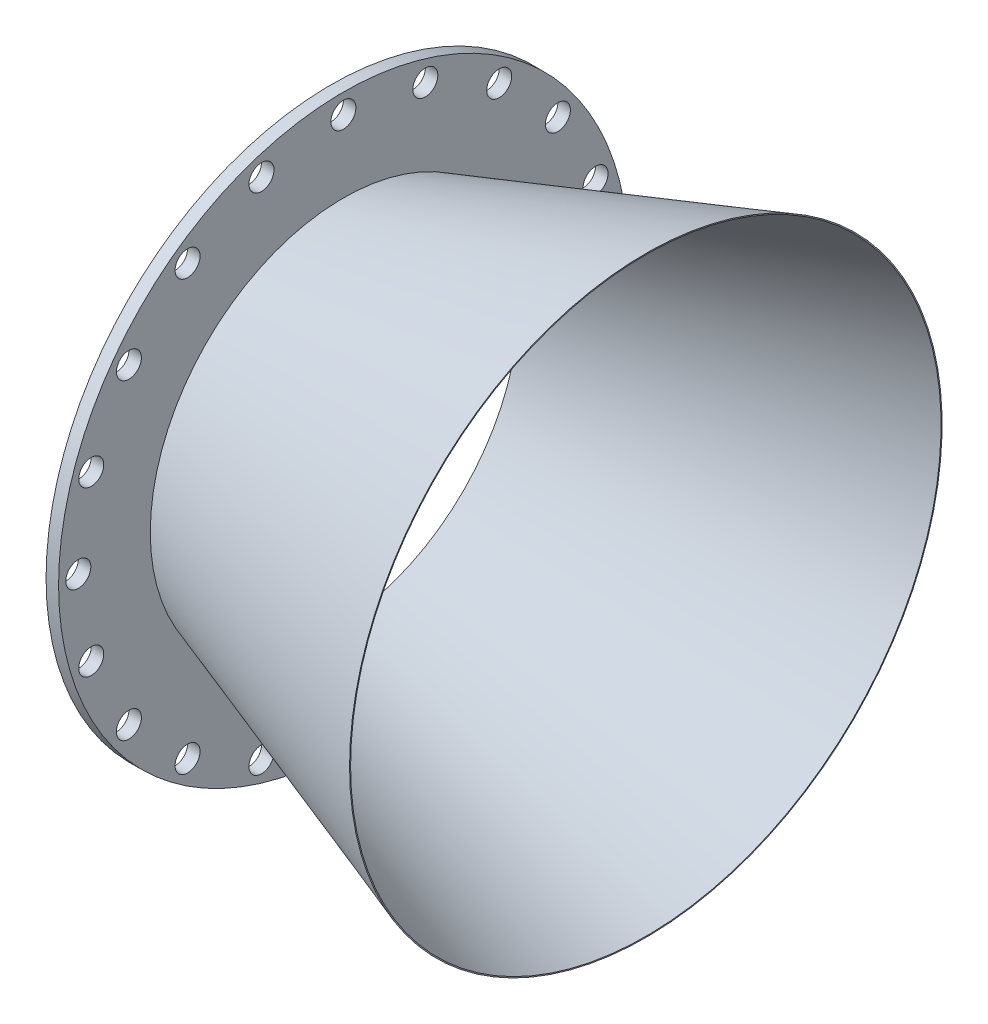
from build123d import *

# Parameters (mm, degrees)
CUT_EXTRUDE1_REACH = 135.082
SKETCH4_R          = 3.175


with BuildPart() as part:
    # Sketch1 → Revolve1 (revolve)
    with BuildSketch(Plane.XY):
        Polygon((0, 47.6758), (79.9592, 74.9554), (79.9592, 75.223775525), (0, 47.944175525), align=None)
    revolve(axis=Axis((0, 0, 0), (1, 0, 0)))

    # Sketch3 → Revolve2 (revolve)
    with BuildSketch(Plane.XY):
        Polygon((0, 47.944175525), (3.175, 49.027387088), (3.175, 72.3138), (0, 72.3138), align=None)
    revolve(axis=Axis((0, 0, 0), (1, 0, 0)))

    # Sketch4 → Cut-Extrude1 (cut, up to next)
    with BuildSketch(Plane.ZY, mode=Mode.PRIVATE) as cut_extrude1_sk1:
        with Locations((0, 67.31)):
            Circle(SKETCH4_R)
    cut_extrude1_tool1 = extrude(cut_extrude1_sk1.sketch, amount=-CUT_EXTRUDE1_REACH, mode=Mode.PRIVATE) & part.part
    # Sketch4 → Cut-Extrude1 (cut, up to next)
    with BuildSketch(Plane.ZY, mode=Mode.PRIVATE) as cut_extrude1_sk2:
        with Locations((20.799933891, 64.015614112)):
            Circle(SKETCH4_R)
    cut_extrude1_tool2 = extrude(cut_extrude1_sk2.sketch, amount=-CUT_EXTRUDE1_REACH, mode=Mode.PRIVATE) & part.part
    # Sketch4 → Cut-Extrude1 (cut, up to next)
    with BuildSketch(Plane.ZY, mode=Mode.PRIVATE) as cut_extrude1_sk3:
        with Locations((39.563825332, 54.454933891)):
            Circle(SKETCH4_R)
    cut_extrude1_tool3 = extrude(cut_extrude1_sk3.sketch, amount=-CUT_EXTRUDE1_REACH, mode=Mode.PRIVATE) & part.part
    # Sketch4 → Cut-Extrude1 (cut, up to next)
    with BuildSketch(Plane.ZY, mode=Mode.PRIVATE) as cut_extrude1_sk4:
        with Locations((54.454933891, 39.563825332)):
            Circle(SKETCH4_R)
    cut_extrude1_tool4 = extrude(cut_extrude1_sk4.sketch, amount=-CUT_EXTRUDE1_REACH, mode=Mode.PRIVATE) & part.part
    # Sketch4 → Cut-Extrude1 (cut, up to next)
    with BuildSketch(Plane.ZY, mode=Mode.PRIVATE) as cut_extrude1_sk5:
        with Locations((64.015614112, 20.799933891)):
            Circle(SKETCH4_R)
    cut_extrude1_tool5 = extrude(cut_extrude1_sk5.sketch, amount=-CUT_EXTRUDE1_REACH, mode=Mode.PRIVATE) & part.part
    # Sketch4 → Cut-Extrude1 (cut, up to next)
    with BuildSketch(Plane.ZY, mode=Mode.PRIVATE) as cut_extrude1_sk6:
        with Locations((67.31, 0)):
            Circle(SKETCH4_R)
    cut_extrude1_tool6 = extrude(cut_extrude1_sk6.sketch, amount=-CUT_EXTRUDE1_REACH, mode=Mode.PRIVATE) & part.part
    # Sketch4 → Cut-Extrude1 (cut, up to next)
    with BuildSketch(Plane.ZY, mode=Mode.PRIVATE) as cut_extrude1_sk7:
        with Locations((64.015614112, -20.799933891)):
            Circle(SKETCH4_R)
    cut_extrude1_tool7 = extrude(cut_extrude1_sk7.sketch, amount=-CUT_EXTRUDE1_REACH, mode=Mode.PRIVATE) & part.part
    # Sketch4 → Cut-Extrude1 (cut, up to next)
    with BuildSketch(Plane.ZY, mode=Mode.PRIVATE) as cut_extrude1_sk8:
        with Locations((54.454933891, -39.563825332)):
            Circle(SKETCH4_R)
    cut_extrude1_tool8 = extrude(cut_extrude1_sk8.sketch, amount=-CUT_EXTRUDE1_REACH, mode=Mode.PRIVATE) & part.part
    # Sketch4 → Cut-Extrude1 (cut, up to next)
    with BuildSketch(Plane.ZY, mode=Mode.PRIVATE) as cut_extrude1_sk9:
        with Locations((39.563825332, -54.454933891)):
            Circle(SKETCH4_R)
    cut_extrude1_tool9 = extrude(cut_extrude1_sk9.sketch, amount=-CUT_EXTRUDE1_REACH, mode=Mode.PRIVATE) & part.part
    # Sketch4 → Cut-Extrude1 (cut, up to next)
    with BuildSketch(Plane.ZY, mode=Mode.PRIVATE) as cut_extrude1_sk10:
        with Locations((20.799933891, -64.015614112)):
            Circle(SKETCH4_R)
    cut_extrude1_tool10 = extrude(cut_extrude1_sk10.sketch, amount=-CUT_EXTRUDE1_REACH, mode=Mode.PRIVATE) & part.part
    # Sketch4 → Cut-Extrude1 (cut, up to next)
    with BuildSketch(Plane.ZY, mode=Mode.PRIVATE) as cut_extrude1_sk11:
        with Locations((0, -67.31)):
            Circle(SKETCH4_R)
    cut_extrude1_tool11 = extrude(cut_extrude1_sk11.sketch, amount=-CUT_EXTRUDE1_REACH, mode=Mode.PRIVATE) & part.part
    # Sketch4 → Cut-Extrude1 (cut, up to next)
    with BuildSketch(Plane.ZY, mode=Mode.PRIVATE) as cut_extrude1_sk12:
        with Locations((-20.799933891, -64.015614112)):
            Circle(SKETCH4_R)
    cut_extrude1_tool12 = extrude(cut_extrude1_sk12.sketch, amount=-CUT_EXTRUDE1_REACH, mode=Mode.PRIVATE) & part.part
    # Sketch4 → Cut-Extrude1 (cut, up to next)
    with BuildSketch(Plane.ZY, mode=Mode.PRIVATE) as cut_extrude1_sk13:
        with Locations((-39.563825332, -54.454933891)):
            Circle(SKETCH4_R)
    cut_extrude1_tool13 = extrude(cut_extrude1_sk13.sketch, amount=-CUT_EXTRUDE1_REACH, mode=Mode.PRIVATE) & part.part
    # Sketch4 → Cut-Extrude1 (cut, up to next)
    with BuildSketch(Plane.ZY, mode=Mode.PRIVATE) as cut_extrude1_sk14:
        with Locations((-54.454933891, -39.563825332)):
            Circle(SKETCH4_R)
    cut_extrude1_tool14 = extrude(cut_extrude1_sk14.sketch, amount=-CUT_EXTRUDE1_REACH, mode=Mode.PRIVATE) & part.part
    # Sketch4 → Cut-Extrude1 (cut, up to next)
    with BuildSketch(Plane.ZY, mode=Mode.PRIVATE) as cut_extrude1_sk15:
        with Locations((-64.015614112, -20.799933891)):
            Circle(SKETCH4_R)
    cut_extrude1_tool15 = extrude(cut_extrude1_sk15.sketch, amount=-CUT_EXTRUDE1_REACH, mode=Mode.PRIVATE) & part.part
    # Sketch4 → Cut-Extrude1 (cut, up to next)
    with BuildSketch(Plane.ZY, mode=Mode.PRIVATE) as cut_extrude1_sk16:
        with Locations((-67.31, 0)):
            Circle(SKETCH4_R)
    cut_extrude1_tool16 = extrude(cut_extrude1_sk16.sketch, amount=-CUT_EXTRUDE1_REACH, mode=Mode.PRIVATE) & part.part
    # Sketch4 → Cut-Extrude1 (cut, up to next)
    with BuildSketch(Plane.ZY, mode=Mode.PRIVATE) as cut_extrude1_sk17:
        with Locations((-64.015614112, 20.799933891)):
            Circle(SKETCH4_R)
    cut_extrude1_tool17 = extrude(cut_extrude1_sk17.sketch, amount=-CUT_EXTRUDE1_REACH, mode=Mode.PRIVATE) & part.part
    # Sketch4 → Cut-Extrude1 (cut, up to next)
    with BuildSketch(Plane.ZY, mode=Mode.PRIVATE) as cut_extrude1_sk18:
        with Locations((-54.454933891, 39.563825332)):
            Circle(SKETCH4_R)
    cut_extrude1_tool18 = extrude(cut_extrude1_sk18.sketch, amount=-CUT_EXTRUDE1_REACH, mode=Mode.PRIVATE) & part.part
    # Sketch4 → Cut-Extrude1 (cut, up to next)
    with BuildSketch(Plane.ZY, mode=Mode.PRIVATE) as cut_extrude1_sk19:
        with Locations((-39.563825332, 54.454933891)):
            Circle(SKETCH4_R)
    cut_extrude1_tool19 = extrude(cut_extrude1_sk19.sketch, amount=-CUT_EXTRUDE1_REACH, mode=Mode.PRIVATE) & part.part
    # Sketch4 → Cut-Extrude1 (cut, up to next)
    with BuildSketch(Plane.ZY, mode=Mode.PRIVATE) as cut_extrude1_sk20:
        with Locations((-20.799933891, 64.015614112)):
            Circle(SKETCH4_R)
    cut_extrude1_tool20 = extrude(cut_extrude1_sk20.sketch, amount=-CUT_EXTRUDE1_REACH, mode=Mode.PRIVATE) & part.part
    add(cut_extrude1_tool1.solids().sort_by_distance((0, 67.31, 0))[0], mode=Mode.SUBTRACT)
    add(cut_extrude1_tool2.solids().sort_by_distance((0, 64.015614, 20.799934))[0], mode=Mode.SUBTRACT)
    add(cut_extrude1_tool3.solids().sort_by_distance((0, 54.454934, 39.563825))[0], mode=Mode.SUBTRACT)
    add(cut_extrude1_tool4.solids().sort_by_distance((0, 39.563825, 54.454934))[0], mode=Mode.SUBTRACT)
    add(cut_extrude1_tool5.solids().sort_by_distance((0, 20.799934, 64.015614))[0], mode=Mode.SUBTRACT)
    add(cut_extrude1_tool6.solids().sort_by_distance((0, 0, 67.31))[0], mode=Mode.SUBTRACT)
    add(cut_extrude1_tool7.solids().sort_by_distance((0, -20.799934, 64.015614))[0], mode=Mode.SUBTRACT)
    add(cut_extrude1_tool8.solids().sort_by_distance((0, -39.563825, 54.454934))[0], mode=Mode.SUBTRACT)
    add(cut_extrude1_tool9.solids().sort_by_distance((0, -54.454934, 39.563825))[0], mode=Mode.SUBTRACT)
    add(cut_extrude1_tool10.solids().sort_by_distance((0, -64.015614, 20.799934))[0], mode=Mode.SUBTRACT)
    add(cut_extrude1_tool11.solids().sort_by_distance((0, -67.31, 0))[0], mode=Mode.SUBTRACT)
    add(cut_extrude1_tool12.solids().sort_by_distance((0, -64.015614, -20.799934))[0], mode=Mode.SUBTRACT)
    add(cut_extrude1_tool13.solids().sort_by_distance((0, -54.454934, -39.563825))[0], mode=Mode.SUBTRACT)
    add(cut_extrude1_tool14.solids().sort_by_distance((0, -39.563825, -54.454934))[0], mode=Mode.SUBTRACT)
    add(cut_extrude1_tool15.solids().sort_by_distance((0, -20.799934, -64.015614))[0], mode=Mode.SUBTRACT)
    add(cut_extrude1_tool16.solids().sort_by_distance((0, 0, -67.31))[0], mode=Mode.SUBTRACT)
    add(cut_extrude1_tool17.solids().sort_by_distance((0, 20.799934, -64.015614))[0], mode=Mode.SUBTRACT)
    add(cut_extrude1_tool18.solids().sort_by_distance((0, 39.563825, -54.454934))[0], mode=Mode.SUBTRACT)
    add(cut_extrude1_tool19.solids().sort_by_distance((0, 54.454934, -39.563825))[0], mode=Mode.SUBTRACT)
    add(cut_extrude1_tool20.solids().sort_by_distance((0, 64.015614, -20.799934))[0], mode=Mode.SUBTRACT)


solid = part.part
